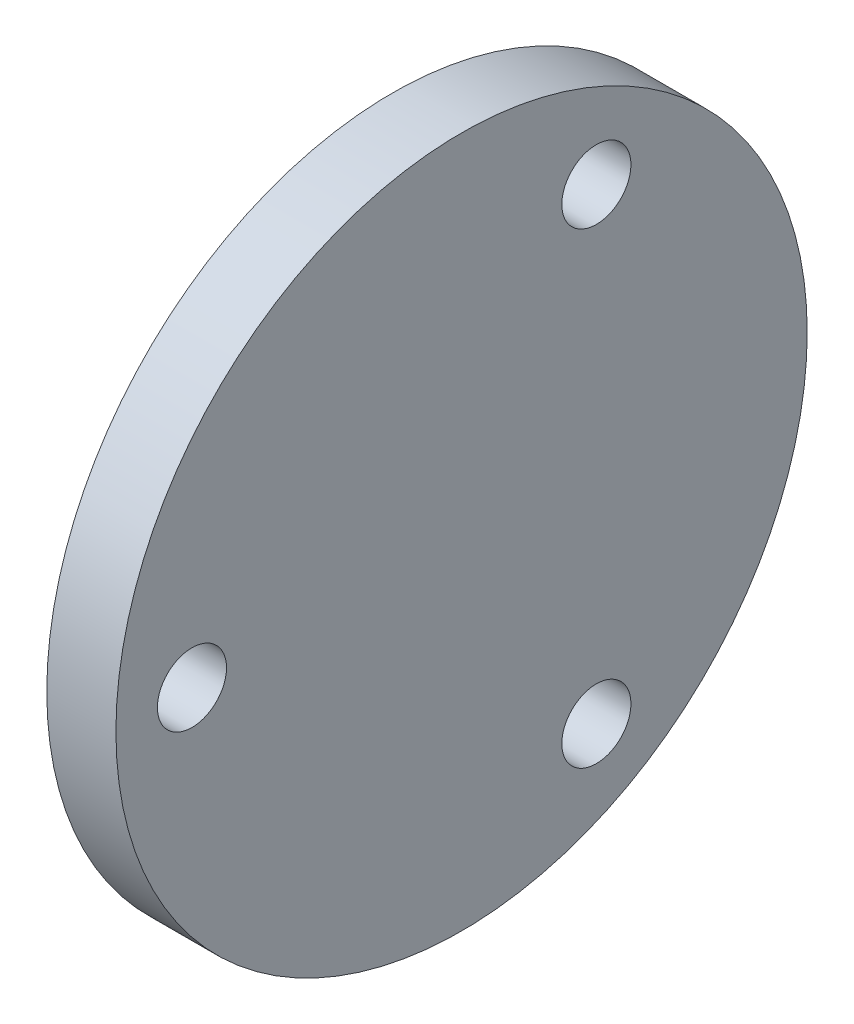
from build123d import *

# Parameters (mm, degrees)
SKETCH1_R           = 25
SKETCH1_R_2         = 2.5
BOSS_EXTRUDE1_DEPTH = 5


with BuildPart() as part:
    # Sketch1 → Boss-Extrude1 (new body)
    with BuildSketch(Plane.YZ):
        Circle(SKETCH1_R)
        with Locations((0, 19.5)):
            Circle(SKETCH1_R_2, mode=Mode.SUBTRACT)
        with Locations((16.887495374, -9.75)):
            Circle(SKETCH1_R_2, mode=Mode.SUBTRACT)
        with Locations((-16.887495374, -9.75)):
            Circle(SKETCH1_R_2, mode=Mode.SUBTRACT)
    extrude(amount=BOSS_EXTRUDE1_DEPTH)


solid = part.part
